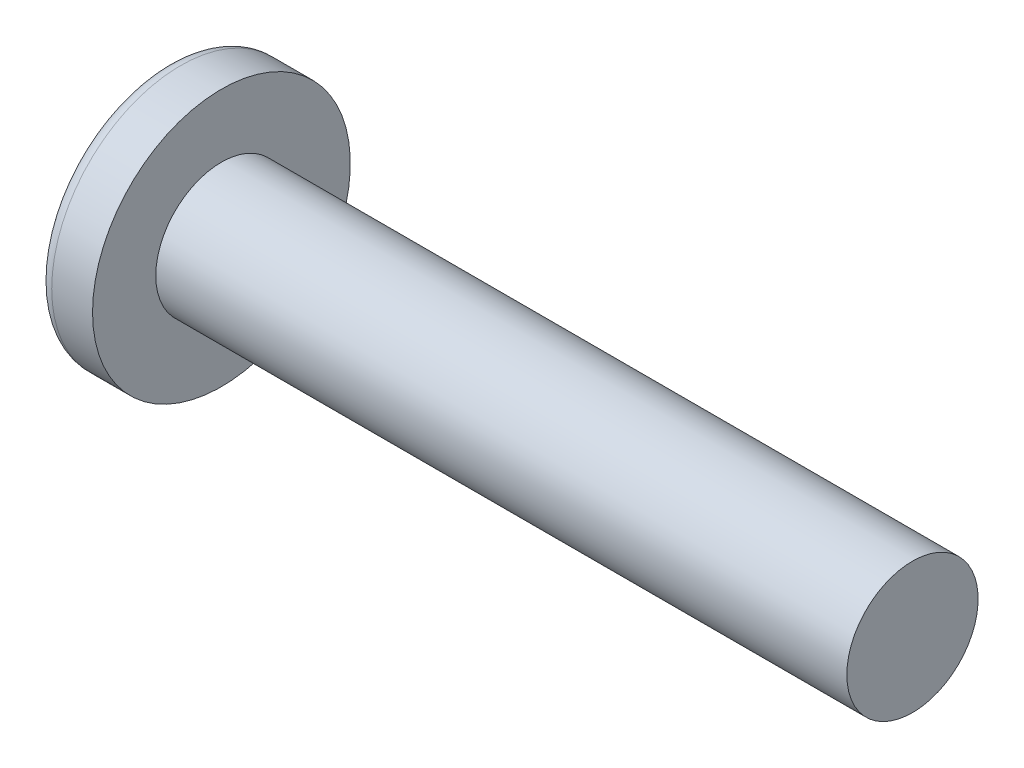
from build123d import *

# Parameters (mm, degrees)
CIRPATTERN1_COUNT = 2
CIRPATTERN1_ANGLE = 90


with BuildPart() as part:
    # BodySke → Base-Revolve (revolve)
    with BuildSketch(Plane.XY):
        with BuildLine():
            Line((3.3782, 2.413), (3.3782, 4.7371))
            Line((3.3782, 4.7371), (1.87773671, 4.7371))
            ThreePointArc((1.87773671, 4.7371), (1.646685378, 4.681514944), (1.466197042, 4.526923944))
            ThreePointArc((1.466197042, 4.526923944), (0.375688687, 2.379221204), (0, 0))
            Line((0, 0), (28.7782, 0))
            Line((28.7782, 0), (28.7782, 2.413))
            Line((28.7782, 2.413), (3.3782, 2.413))
        make_face()
    revolve(axis=Axis((-25.4, 0, 0), (1, 0, 0)))

    # Sketch3 → Cut-Loft1 section 0
    with BuildSketch(Plane(origin=(0, 0, 0), x_dir=(0, 0, -1), z_dir=(1, 0, 0))):
        with BuildLine():
            Line((0.5842, -3.048), (-0.5842, -3.048))
            Line((-0.5842, -3.048), (-0.5842, 3.048))
            Line((-0.5842, 3.048), (0.5842, 3.048))
            Line((0.5842, 3.048), (0.5842, -3.048))
        make_face()
    # Sketch4 → Cut-Loft1 section 1
    with BuildSketch(Plane(origin=(3.4798, 0, 0), x_dir=(0, 0, -1), z_dir=(1, 0, 0))):
        with BuildLine():
            Line((0.2921, -0.2921), (-0.2921, -0.2921))
            Line((-0.2921, -0.2921), (-0.2921, 0.2921))
            Line((-0.2921, 0.2921), (0.2921, 0.2921))
            Line((0.2921, 0.2921), (0.2921, -0.2921))
        make_face()
    cut_loft1 = loft(mode=Mode.SUBTRACT)

    # CirPattern1: Cut-Loft1 ×2 about axis
    cirpattern1_axis = Axis((-25.4, 0, 0), (1, 0, 0))
    for i in range(1, CIRPATTERN1_COUNT):
        add(cut_loft1.rotate(cirpattern1_axis, i * CIRPATTERN1_ANGLE / (CIRPATTERN1_COUNT - 1)), mode=Mode.SUBTRACT)


solid = part.part
